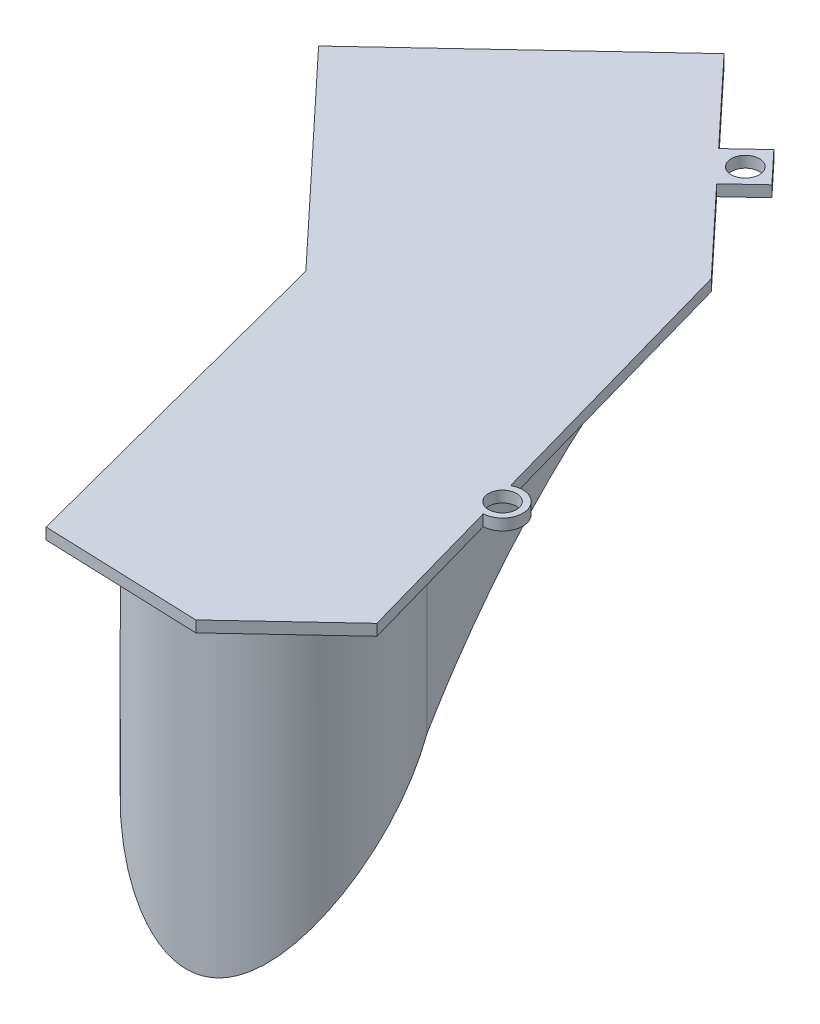
from build123d import *

# Parameters (mm, degrees)
SKETCH3_R               = 3.175
BOSS_EXTRUDE1_DEPTH     = 2.54
BOSS_EXTRUDE2_DEPTH     = 76.2
CUT_EXTRUDE1_DEPTH      = 159.608869597
CUT_EXTRUDE1_DEPTH_BACK = 159.608869597


with BuildPart() as part:
    # Sketch3 → Boss-Extrude1 (new body)
    with BuildSketch(Plane(origin=(0, 0, 0), x_dir=(1, 0, 0), z_dir=(0, 1, 0))):
        with BuildLine():
            Line((-0.667272367, 91.211244064), (42.072585982, 45.579833776))
            Line((42.072585982, 45.579833776), (62.900199296, -34.141504839))
            Line((62.900199296, -34.141504839), (98.113451188, -35.418279698))
            Line((98.113451188, -35.418279698), (119.317385982, -15.557986891))
            Line((119.317385982, -15.557986891), (109.850299083, 18.019409705))
            ThreePointArc((109.850299083, 18.019409705), (114.061816463, 23.863253473), (107.41792498, 26.646434133))
            Line((107.41792498, 26.646434133), (89.543483254, 90.042621912))
            Line((89.543483254, 90.042621912), (71.515910096, 109.289844975))
            Line((71.515910096, 109.289844975), (77.978605526, 115.34301505))
            Line((77.978605526, 115.34301505), (71.293896806, 122.479975678))
            Line((71.293896806, 122.479975678), (64.831201375, 116.426805602))
            Line((64.831201375, 116.426805602), (46.803628217, 135.674028665))
            Line((46.803628217, 135.674028665), (-0.667272367, 91.211244064))
        make_face()
        with Locations((71.405004975, 115.88499878)):
            Circle(SKETCH3_R, mode=Mode.SUBTRACT)
        with Locations((109.633944273, 22.61482283)):
            Circle(SKETCH3_R, mode=Mode.SUBTRACT)
    extrude(amount=BOSS_EXTRUDE1_DEPTH)

    # Sketch4 → Boss-Extrude2 (add)
    with BuildSketch(Plane(origin=(0, 2.54, 0), x_dir=(1, 0, 0), z_dir=(0, 1, 0))):
        with BuildLine():
            Line((46.803628217, 129.736619854), (5.454929405, 91.008087929))
            Line((5.454929405, 91.008087929), (46.353114934, 47.342948269))
            Line((46.353114934, 47.342948269), (61.1366863, -10.500532511))
            ThreePointArc((61.1366863, -10.500532511), (94.212402493, -28.283463558), (108.844487247, 6.301760657))
            Line((108.844487247, 6.301760657), (86.410796294, 87.200194916))
            Line((86.410796294, 87.200194916), (46.803628217, 129.736619854))
        make_face()
    extrude(amount=-BOSS_EXTRUDE2_DEPTH)

    # Sketch14 → Cut-Extrude1 (cut, two sides: drawn at the far end of the back side and taken through both)
    with BuildSketch(Plane(origin=(50.531559178, 0, -13.201631997), x_dir=(0.25277120811930814, 0, 0.9675260804473983), z_dir=(-0.9675260804473983, 0, 0.25277120811930814)).offset(-CUT_EXTRUDE1_DEPTH_BACK)):
        with BuildLine():
            Line((-119.586340422, -76.2), (-7.964682874, -76.2))
            Line((-7.964682874, -76.2), (52.762632555, -76.2))
            ThreePointArc((52.762632555, -76.2), (9.204123856, -25.310156709), (-52.816161516, 0))
            Line((-52.816161516, 0), (-119.586340422, 0))
            Line((-119.586340422, 0), (-119.586340422, -76.2))
        make_face()
    extrude(amount=CUT_EXTRUDE1_DEPTH + CUT_EXTRUDE1_DEPTH_BACK, mode=Mode.SUBTRACT)


solid = part.part
